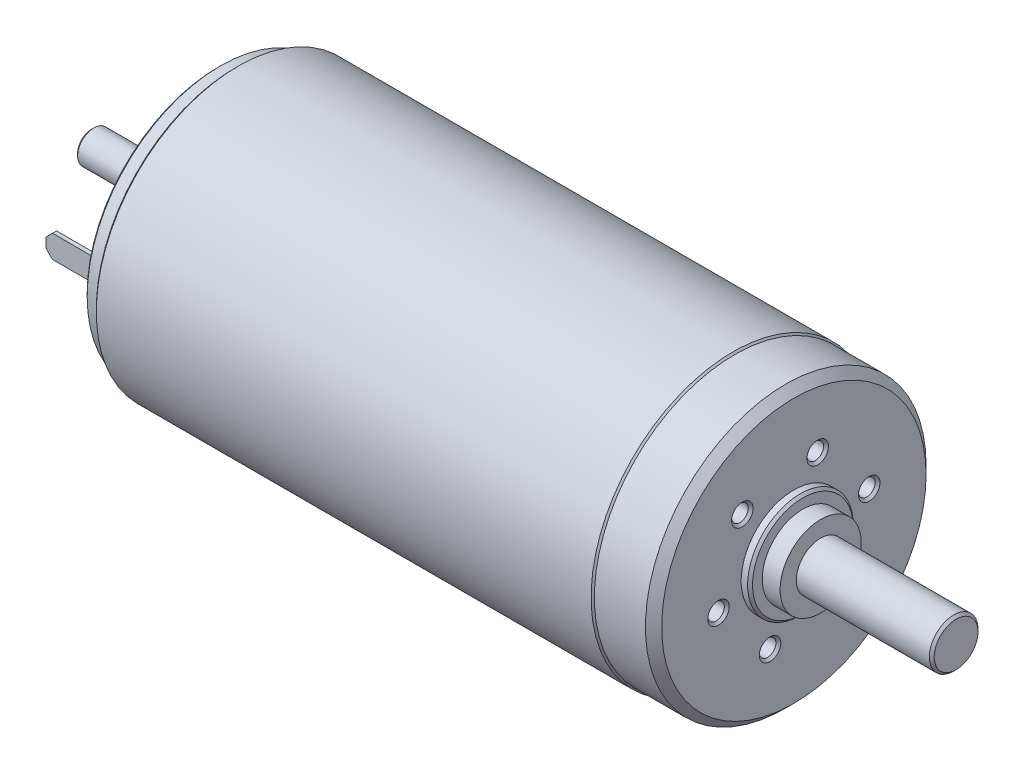
from build123d import *

# Parameters (mm, degrees)
SKETCH1_R                          = 17.5
BOSS_EXTRUDE1_DEPTH                = 61.5
SKETCH3_R                          = 17.3
BOSS_EXTRUDE2_DEPTH                = 7.3
SKETCH4_R                          = 6.5
BOSS_EXTRUDE3_DEPTH                = 1.1
SKETCH5_R                          = 5
BOSS_EXTRUDE4_DEPTH                = 2.2
SKETCH6_R                          = 3
BOSS_EXTRUDE5_DEPTH                = 16.7
SKETCH7_R                          = 16.425
BOSS_EXTRUDE6_DEPTH                = 2.2
BOSS_EXTRUDE7_START                = 1.35
SKETCH8_R                          = 6.5
BOSS_EXTRUDE7_DEPTH                = 1.35
SKETCH9_R                          = 3.5
BOSS_EXTRUDE8_DEPTH                = 2.05
SKETCH10_R                         = 2
BOSS_EXTRUDE9_DEPTH                = 12.2
BOSS_EXTRUDE10_DEPTH               = 8
CHAMFER1_SIZE                      = 0.3
CHAMFER2_SIZE                      = 0.2
CHAMFER3_SIZE                      = 1
CHAMFER4_SIZE                      = 0.8
M2_5X0_45_TAPPED_HOLE1_D           = 2.05
M2_5X0_45_TAPPED_HOLE1_DEPTH       = 4.5
M2_5X0_45_TAPPED_HOLE1_CSINK_D     = 2.65
M2_5X0_45_TAPPED_HOLE1_CSINK_ANGLE = 90
M2_5X0_45_TAPPED_HOLE1_TIP         = 0.615882135
M2X0_4_TAPPED_HOLE1_D              = 1.6
M2X0_4_TAPPED_HOLE1_DEPTH          = 3
M2X0_4_TAPPED_HOLE1_CSINK_D        = 2.1
M2X0_4_TAPPED_HOLE1_CSINK_ANGLE    = 90
M2X0_4_TAPPED_HOLE1_TIP            = 0.480688495
M1_6X0_35_TAPPED_HOLE1_D           = 1.25
M1_6X0_35_TAPPED_HOLE1_DEPTH       = 4.95
M1_6X0_35_TAPPED_HOLE1_CSINK_D     = 1.7
M1_6X0_35_TAPPED_HOLE1_CSINK_ANGLE = 90
M1_6X0_35_TAPPED_HOLE1_TIP         = 0.375537887


with BuildPart() as part:
    # Sketch1 → Boss-Extrude1 (new body)
    with BuildSketch(Plane(origin=(0, 0, 0), x_dir=(0, 0, -1), z_dir=(1, 0, 0))):
        Circle(SKETCH1_R)
    extrude(amount=-BOSS_EXTRUDE1_DEPTH)

    # Sketch3 → Boss-Extrude2 (add)
    with BuildSketch(Plane(origin=(0, 0, 0), x_dir=(0, 0, -1), z_dir=(1, 0, 0))):
        Circle(SKETCH3_R)
    extrude(amount=BOSS_EXTRUDE2_DEPTH)

    # Sketch4 → Boss-Extrude3 (add)
    with BuildSketch(Plane(origin=(7.3, 0, 0), x_dir=(0, 0, -1), z_dir=(1, 0, 0))):
        Circle(SKETCH4_R)
    extrude(amount=BOSS_EXTRUDE3_DEPTH)

    # Sketch5 → Boss-Extrude4 (add)
    with BuildSketch(Plane(origin=(8.4, 0, 0), x_dir=(0, 0, -1), z_dir=(1, 0, 0))):
        Circle(SKETCH5_R)
    extrude(amount=BOSS_EXTRUDE4_DEPTH)

    # Sketch6 → Boss-Extrude5 (add)
    with BuildSketch(Plane(origin=(10.6, 0, 0), x_dir=(0, 0, -1), z_dir=(1, 0, 0))):
        Circle(SKETCH6_R)
    extrude(amount=BOSS_EXTRUDE5_DEPTH)

    # Sketch7 → Boss-Extrude6 (add)
    with BuildSketch(Plane.ZY.offset(61.5)):
        with Locations(Location((0, 0, 0), (0, 0, 180))):
            Circle(SKETCH7_R)
    extrude(amount=BOSS_EXTRUDE6_DEPTH)

    # Sketch8 → Boss-Extrude7 (add)
    with BuildSketch(Plane.ZY.offset(63.7).offset(BOSS_EXTRUDE7_START)):
        with Locations(Location((0, 0, 0), (0, 0, 180))):
            Circle(SKETCH8_R)
    extrude(amount=-BOSS_EXTRUDE7_DEPTH)

    # Sketch9 → Boss-Extrude8 (add)
    with BuildSketch(Plane.ZY.offset(65.05)):
        Circle(SKETCH9_R)
    extrude(amount=BOSS_EXTRUDE8_DEPTH)

    # Sketch10 → Boss-Extrude9 (add)
    with BuildSketch(Plane.ZY.offset(67.1)):
        Circle(SKETCH10_R)
    extrude(amount=BOSS_EXTRUDE9_DEPTH)

    # Sketch11 → Boss-Extrude10 (add)
    with BuildSketch(Plane.ZY.offset(63.7)):
        Polygon((-12.7, 1.4), (-13.2, 1.4), (-13.2, 0), (-13.2, -1.4), (-12.7, -1.4), (-12.7, 0), align=None)
        Polygon((12.7, -1.4), (13.2, -1.4), (13.2, 0), (13.2, 1.4), (12.7, 1.4), (12.7, 0), align=None)
    extrude(amount=BOSS_EXTRUDE10_DEPTH)

    # Chamfer1
    chamfer1_edges = [part.edges().sort_by_distance(p)[0] for p in [
        (8.4, 0, 6.5),
        (27.3, 0, 3),
        (-63.7, 0, 16.425),
        (-65.05, 0, 6.5),
        (-79.3, 0, -2),
        (-61.5, 0, 17.5),
    ]]
    chamfer(chamfer1_edges, length=CHAMFER1_SIZE)

    # Chamfer2
    chamfer2_edges = [part.edges().sort_by_distance(p)[0] for p in [
        (0, 0, 17.5),
    ]]
    chamfer(chamfer2_edges, length=CHAMFER2_SIZE - 0.0001)  # a hair under: the kernel refuses the full size

    # Chamfer3
    chamfer3_edges = [part.edges().sort_by_distance(p)[0] for p in [
        (7.3, 0, 17.3),
    ]]
    chamfer(chamfer3_edges, length=CHAMFER3_SIZE)

    # Chamfer4
    chamfer4_edges = [part.edges().sort_by_distance(p)[0] for p in [
        (-71.7, 1.4, -12.95),
        (-71.7, -1.4, -12.95),
        (-71.7, -1.4, 12.95),
        (-71.7, 1.4, 12.95),
    ]]
    chamfer(chamfer4_edges, length=CHAMFER4_SIZE)

    # M2.5x0.45 Tapped Hole1
    with Locations(Plane(origin=(7.3, 0, 0), x_dir=(0, 0, -1), z_dir=(1, 0, 0))):
        with Locations((-6.35674076, 7.059875842), (2.935661447, 9.035036905), (9.292402207, 1.975161063), (6.35674076, -7.059875842), (-2.935661447, -9.035036905), (-9.292402207, -1.975161063)):
            CounterSinkHole(M2_5X0_45_TAPPED_HOLE1_D / 2, M2_5X0_45_TAPPED_HOLE1_CSINK_D / 2, depth=M2_5X0_45_TAPPED_HOLE1_DEPTH, counter_sink_angle=M2_5X0_45_TAPPED_HOLE1_CSINK_ANGLE)
            with Locations((0, 0, -(M2_5X0_45_TAPPED_HOLE1_DEPTH + M2_5X0_45_TAPPED_HOLE1_TIP / 2))):  # 118° drill point
                Cone(0, M2_5X0_45_TAPPED_HOLE1_D / 2, M2_5X0_45_TAPPED_HOLE1_TIP, mode=Mode.SUBTRACT)

    # M2x0.4 Tapped Hole1
    with Locations(Plane.ZY.offset(63.7)):
        with Locations((8.619260655, 11.03215055), (-5.244492308, 12.980573964), (-8.619260655, -11.03215055), (5.244492308, -12.980573964)):
            CounterSinkHole(M2X0_4_TAPPED_HOLE1_D / 2, M2X0_4_TAPPED_HOLE1_CSINK_D / 2, depth=M2X0_4_TAPPED_HOLE1_DEPTH, counter_sink_angle=M2X0_4_TAPPED_HOLE1_CSINK_ANGLE)
            with Locations((0, 0, -(M2X0_4_TAPPED_HOLE1_DEPTH + M2X0_4_TAPPED_HOLE1_TIP / 2))):  # 118° drill point
                Cone(0, M2X0_4_TAPPED_HOLE1_D / 2, M2X0_4_TAPPED_HOLE1_TIP, mode=Mode.SUBTRACT)

    # M1.6x0.35 Tapped Hole1
    with Locations(Plane.ZY.offset(63.7)):
        with Locations((-6.540983551, 10.886024719), (-10.886024719, -6.540983551), (6.540983551, -10.886024719), (10.886024719, 6.540983551)):
            CounterSinkHole(M1_6X0_35_TAPPED_HOLE1_D / 2, M1_6X0_35_TAPPED_HOLE1_CSINK_D / 2, depth=M1_6X0_35_TAPPED_HOLE1_DEPTH, counter_sink_angle=M1_6X0_35_TAPPED_HOLE1_CSINK_ANGLE)
            with Locations((0, 0, -(M1_6X0_35_TAPPED_HOLE1_DEPTH + M1_6X0_35_TAPPED_HOLE1_TIP / 2))):  # 118° drill point
                Cone(0, M1_6X0_35_TAPPED_HOLE1_D / 2, M1_6X0_35_TAPPED_HOLE1_TIP, mode=Mode.SUBTRACT)


solid = part.part
